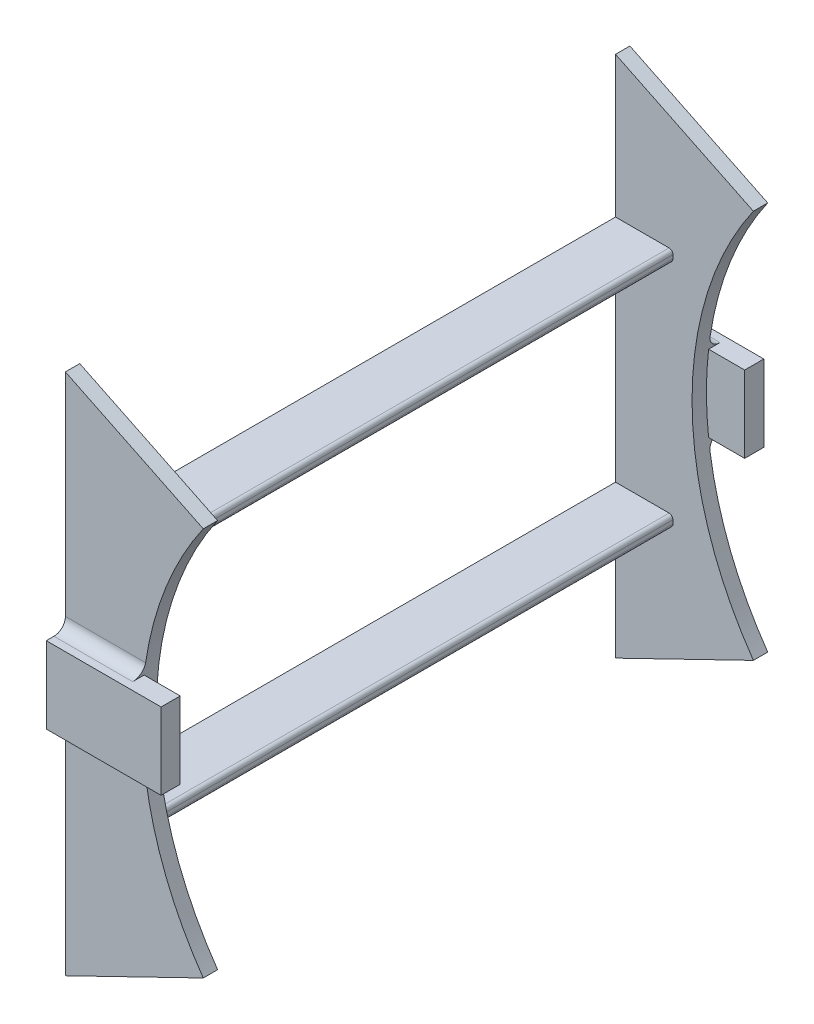
from build123d import *

# Parameters (mm, degrees)
BOSS_EXTRUDE1_DEPTH = 1.875
BOSS_EXTRUDE3_DEPTH = 140
BOSS_EXTRUDE4_DEPTH = 5
FILLET4_R           = 3


with BuildPart() as part:
    # Sketch1 → Boss-Extrude1 (new, symmetric)
    with BuildSketch(Plane.XY):
        with BuildLine():
            Line((-72.585877034, -50.825178267), (-108.610994186, -68.325178267))
            Line((-108.610994186, -68.325178267), (-108.610994186, 68.325178267))
            Line((-108.610994186, 68.325178267), (-72.585877034, 50.825178267))
            ThreePointArc((-72.585877034, 50.825178267), (-88.610994186, 0), (-72.585877034, -50.825178267))
        make_face()
    boss_extrude1 = extrude(amount=BOSS_EXTRUDE1_DEPTH, both=True)

    # Sketch3 → Boss-Extrude3 (add)
    with BuildSketch(Plane.XY.offset(1.875)):
        with BuildLine():
            Line((-108.610994186, -28.5), (-108.610994186, -31.5))
            Line((-108.610994186, -31.5), (-94.610994186, -31.5))
            ThreePointArc((-94.610994186, -31.5), (-93.903887405, -31.207106781), (-93.610994186, -30.5))
            Line((-93.610994186, -30.5), (-93.610994186, -29.5))
            ThreePointArc((-93.610994186, -29.5), (-93.903887405, -28.792893219), (-94.610994186, -28.5))
            Line((-94.610994186, -28.5), (-108.610994186, -28.5))
        make_face()
    boss_extrude3 = extrude(amount=BOSS_EXTRUDE3_DEPTH)

    # Mirror2: Boss-Extrude3 across plane
    add(boss_extrude3.mirror(Plane.ZX))

    # Mirror7: Boss-Extrude1 across plane
    add(boss_extrude1.mirror(Plane.XY.offset(71.875)))

    # Sketch4 → Boss-Extrude4 (add)
    with BuildSketch(Plane(origin=(0, 0, -1.875), x_dir=(-1, 0, 0), z_dir=(0, 0, -1))):
        Polygon((108.610994186, 0), (108.610994186, 10), (78.610994186, 10), (78.610994186, -10), (108.610994186, -10), align=None)
    boss_extrude4 = extrude(amount=BOSS_EXTRUDE4_DEPTH)

    # Mirror10: Boss-Extrude4 across plane
    add(boss_extrude4.mirror(Plane.XY.offset(71.875)))

    # Fillet4
    fillet4_edges = [part.edges().sort_by_distance(p)[0] for p in [
        (-98.327958095, -10, -1.875),
        (-98.327958095, 10, -1.875),
        (-98.327958095, 10, 145.625),
        (-98.327958095, -10, 145.625),
    ]]
    fillet(fillet4_edges, radius=FILLET4_R)


solid = part.part
